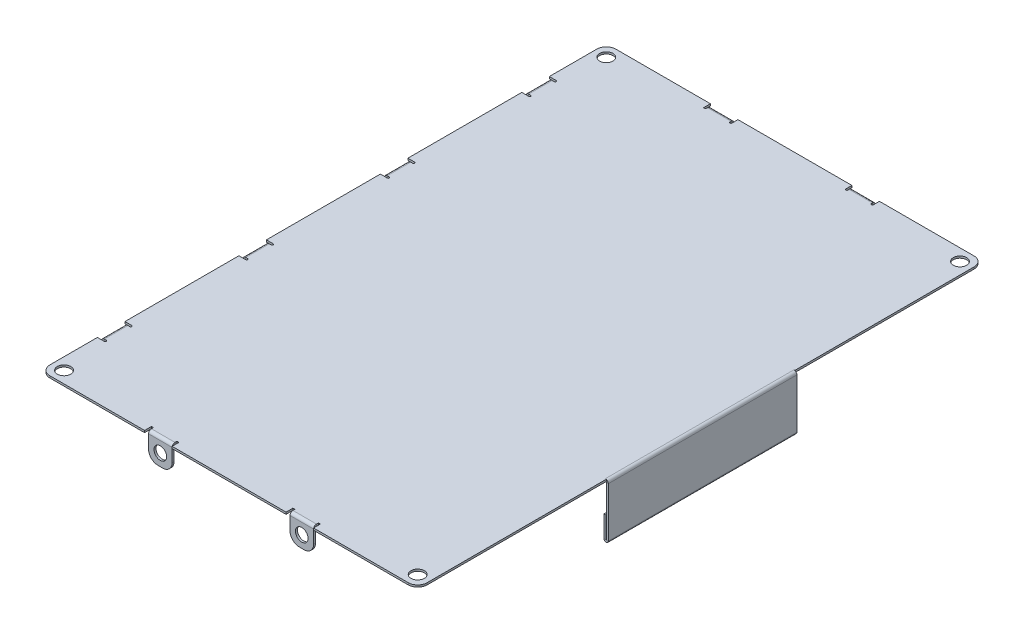
from build123d import *

# Parameters (mm, degrees)
BASE_FLANGE1_DEPTH             = 0.53
EDGE_FLANGE2_STRIP_W           = 3.158
EDGE_FLANGE2_STRIP_H           = 0.53
EDGE_FLANGE2_STRIP_CUT_DEPTH   = 6.35
EDGE_FLANGE2_RELIEF_W          = 3.688
EDGE_FLANGE2_RELIEF_H          = 0.53
EDGE_FLANGE2_RELIEF_CUT_DEPTH  = 0.53
EDGE_FLANGE2_DEPTH             = 6.35
EDGE_FLANGE2_FLAT_DEPTH        = 0.53
EDGE_FLANGE4_START             = -0.53
EDGE_FLANGE4_OUTLINE_W         = 7.41
EDGE_FLANGE4_OUTLINE_H         = 0.53
EDGE_FLANGE4_DEPTH             = 0.53
EDGE_FLANGE4_START_2           = -1.844
EDGE_FLANGE4_2_OUTLINE_W       = 0.53
EDGE_FLANGE4_2_OUTLINE_H       = 0.53
EDGE_FLANGE4_2_DEPTH           = 1.314
EDGE_FLANGE4_START_3           = 33.411716927
EDGE_FLANGE4_3_DEPTH           = 1.588283073
EDGE_FLANGE4_START_4           = 29.624923007
EDGE_FLANGE4_4_OUTLINE_W       = 0.53
EDGE_FLANGE4_4_OUTLINE_H       = 6.35
EDGE_FLANGE4_4_DEPTH           = 3.556
EDGE_FLANGE4_START_5           = -25.124
EDGE_FLANGE4_5_DEPTH           = 0.53
EDGE_FLANGE4_START_6           = -60.323203949
EDGE_FLANGE4_6_DEPTH           = 6.35
EDGE_FLANGE4_7_DEPTH           = 6.35
EDGE_FLANGE5_START             = -0.53
EDGE_FLANGE5_OUTLINE_W         = 7.41
EDGE_FLANGE5_OUTLINE_H         = 0.53
EDGE_FLANGE5_DEPTH             = 0.53
EDGE_FLANGE5_START_2           = -1.844
EDGE_FLANGE5_2_OUTLINE_W       = 0.53
EDGE_FLANGE5_2_OUTLINE_H       = 0.53
EDGE_FLANGE5_2_DEPTH           = 1.314
EDGE_FLANGE5_START_3           = -22.223203949
EDGE_FLANGE5_3_DEPTH           = 6.35
EDGE_FLANGE5_4_DEPTH           = 6.35
EDGE_FLANGE5_START_4           = 29.47371193
EDGE_FLANGE5_5_DEPTH           = 5.52628807
EDGE_FLANGE5_START_5           = -25.124
EDGE_FLANGE5_6_DEPTH           = 0.53
M3_CLEARANCE_HOLE2_D           = 3.4
M3_CLEARANCE_HOLE2_ON_FACE_2_D = 3.4
EDGE_FLANGE6_STRIP_W           = 2.628
EDGE_FLANGE6_STRIP_H           = 0.53
EDGE_FLANGE6_STRIP_CUT_DEPTH   = 25.4
EDGE_FLANGE6_DEPTH             = 25.4
HEM1_START                     = -76.198203949
HEM1_DEPTH                     = 25.4
HEM1_2_DEPTH                   = 25.4
M3_CLEARANCE_HOLE1_D           = 3.6


with BuildPart() as part:
    # Base-Flange1: sheet metal written as solids
    # Sketch1 → Base-Flange1 (new body)
    with BuildSketch(Plane(origin=(0, 33.434923007, 0), x_dir=(1, 0, 0), z_dir=(0, 1, 0))):
        with BuildLine():
            Line((-23.114, 0), (25.146, 0))
            Line((25.146, 0), (25.146, 76.198203949))
            Line((25.146, 76.198203949), (-25.654, 76.198203949))
            Line((-25.654, 76.198203949), (-25.654, 2.54))
            ThreePointArc((-25.654, 2.54), (-24.910051224, 0.743948776), (-23.114, 0))
        make_face()
    extrude(amount=BASE_FLANGE1_DEPTH)

    # Edge-Flange2: sheet metal written as solids
    # Edge-Flange2 strip (on a plane across the edge) → Edge-Flange2 strip cut (cut)
    with BuildSketch(Plane(origin=(9.271, 33.434923007, -0.53), x_dir=(0, 0, -1), z_dir=(-1, 0, 0))):
        with Locations((-0.795, -0.265)):
            Rectangle(EDGE_FLANGE2_STRIP_W, EDGE_FLANGE2_STRIP_H)
    extrude(amount=EDGE_FLANGE2_STRIP_CUT_DEPTH, mode=Mode.SUBTRACT)

    # Edge-Flange2 relief (on the sheet) → Edge-Flange2 relief cut (cut)
    with BuildSketch(Plane(origin=(9.271, 33.434923007, -1.314), x_dir=(0, 0, -1), z_dir=(0, -1, 0))):
        with Locations((-1.314, 0.265)):
            Rectangle(EDGE_FLANGE2_RELIEF_W, EDGE_FLANGE2_RELIEF_H)
        with Locations((-1.314, -6.615)):
            Rectangle(EDGE_FLANGE2_RELIEF_W, EDGE_FLANGE2_RELIEF_H)
    extrude(amount=-EDGE_FLANGE2_RELIEF_CUT_DEPTH, mode=Mode.SUBTRACT)

    # Edge-Flange2 bend section (on a plane across the edge) → Edge-Flange2 (add)
    with BuildSketch(Plane(origin=(9.271, 33.434923007, -0.53), x_dir=(0, 0, -1), z_dir=(-1, 0, 0))):
        with BuildLine():
            Line((0, 0.254), (0.53, 0.254))
            ThreePointArc((0.53, 0.254), (0.604394878, 0.074394878), (0.784, 0))
            Line((0.784, 0), (0.784, -0.53))
            ThreePointArc((0.784, -0.53), (0.229628284, -0.300371716), (0, 0.254))
        make_face()
    extrude(amount=EDGE_FLANGE2_DEPTH)

    # Edge-Flange2 profile (on flange) → Edge-Flange2 flat (add)
    with BuildSketch(Plane(origin=(0, 33.434923007, -0.53), x_dir=(-1, 0, 0), z_dir=(0, 0, 1))):
        with BuildLine():
            Line((-9.271, 0.254), (-2.921, 0.254))
            Line((-2.921, 0.254), (-2.921, 3.81))
            ThreePointArc((-2.921, 3.81), (-3.664948776, 5.606051224), (-5.461, 6.35))
            Line((-5.461, 6.35), (-6.731, 6.35))
            ThreePointArc((-6.731, 6.35), (-8.527051224, 5.606051224), (-9.271, 3.81))
            Line((-9.271, 3.81), (-9.271, 0.254))
        make_face()
    extrude(amount=-EDGE_FLANGE2_FLAT_DEPTH)

    # Mirror2: part across plane


with BuildPart() as part_1:
    add(part.part)
    add(part.part.mirror(Plane(origin=(25.146, 33.964923007, 0), x_dir=(0, 0, 1), z_dir=(-1, 0, 0))))

    # Edge-Flange4: read off the stored shape, not the designer's step
    # Edge-Flange4 outline → Edge-Flange4 (cut)
    with BuildSketch(Plane(origin=(-25.654, 33.434923007, 0), x_dir=(0, 0, -1), z_dir=(-1, 0, 0)).offset(EDGE_FLANGE4_START)):
        with Locations((57.148203949, -0.265)):
            Rectangle(EDGE_FLANGE4_OUTLINE_W, EDGE_FLANGE4_OUTLINE_H)
    extrude(amount=EDGE_FLANGE4_DEPTH, mode=Mode.SUBTRACT)

    # Edge-Flange4 2 outline → Edge-Flange4 2 (cut)
    with BuildSketch(Plane(origin=(-25.654, 33.434923007, 0), x_dir=(0, 0, -1), z_dir=(-1, 0, 0)).offset(EDGE_FLANGE4_START_2)):
        with Locations((53.708203949, -0.265)):
            Rectangle(EDGE_FLANGE4_2_OUTLINE_W, EDGE_FLANGE4_2_OUTLINE_H)
        with Locations((60.588203949, -0.265)):
            Rectangle(EDGE_FLANGE4_2_OUTLINE_W, EDGE_FLANGE4_2_OUTLINE_H)
    extrude(amount=EDGE_FLANGE4_2_DEPTH, mode=Mode.SUBTRACT)

    # Edge-Flange4 3 outline → Edge-Flange4 3 (cut)
    with BuildSketch(Plane(origin=(0, 0, 0), x_dir=(1, 0, 0), z_dir=(0, 1, 0)).offset(EDGE_FLANGE4_START_3)):
        with BuildLine():
            Line((-23.81, 60.853203949), (-23.81, 60.323203949))
            ThreePointArc((-23.81, 60.323203949), (-23.545, 60.588203949), (-23.81, 60.853203949))
        make_face()
        with BuildLine():
            ThreePointArc((-23.81, 53.443203949), (-23.545, 53.708203949), (-23.81, 53.973203949))
            Line((-23.81, 53.973203949), (-23.81, 53.443203949))
        make_face()
    extrude(amount=EDGE_FLANGE4_3_DEPTH, mode=Mode.SUBTRACT)



with BuildPart() as body_2:
    # Edge-Flange4 4 outline → Edge-Flange4 4 (new body)
    with BuildSketch(Plane(origin=(0, 0, 0), x_dir=(1, 0, 0), z_dir=(0, 1, 0)).offset(EDGE_FLANGE4_START_4)):
        with Locations((-24.859, 57.148203949)):
            Rectangle(EDGE_FLANGE4_4_OUTLINE_W, EDGE_FLANGE4_4_OUTLINE_H)
    extrude(amount=EDGE_FLANGE4_4_DEPTH)

    # Edge-Flange4 5 outline → Edge-Flange4 5 (add)
    with BuildSketch(Plane.YZ.offset(EDGE_FLANGE4_START_5)):
        with BuildLine():
            Line((27.084923007, -56.513203949), (27.084923007, -57.783203949))
            ThreePointArc((27.084923007, -57.783203949), (27.828871783, -59.579255173), (29.624923007, -60.323203949))
            Line((29.624923007, -60.323203949), (29.624923007, -53.973203949))
            ThreePointArc((29.624923007, -53.973203949), (27.828871783, -54.717152725), (27.084923007, -56.513203949))
        make_face()
    extrude(amount=EDGE_FLANGE4_5_DEPTH)


with BuildPart() as part_2:
    add(part_1.part)

    add(body_2.part)  # Edge-Flange4 6 merges body 2
    # Edge-Flange4 6 outline → Edge-Flange4 6 (add)
    with BuildSketch(Plane.XY.offset(EDGE_FLANGE4_START_6)):
        with BuildLine():
            ThreePointArc((-25.08171423, 33.434923007), (-25.113356307, 33.309670906), (-25.124, 33.180923007))
            Line((-25.124, 33.180923007), (-24.594, 33.180923007))
            ThreePointArc((-24.594, 33.180923007), (-24.519605122, 33.360528129), (-24.34, 33.434923007))
            Line((-24.34, 33.434923007), (-25.08171423, 33.434923007))
        make_face()
    extrude(amount=EDGE_FLANGE4_6_DEPTH)

    # Edge-Flange4 7 outline → Edge-Flange4 7 (cut)
    with BuildSketch(Plane.XY.offset(EDGE_FLANGE4_START_6)):
        with BuildLine():
            Line((-25.124, 33.434923007), (-25.08171423, 33.434923007))
            ThreePointArc((-25.08171423, 33.434923007), (-24.795806976, 33.818807009), (-24.34, 33.964923007))
            Line((-24.34, 33.964923007), (-25.124, 33.964923007))
            Line((-25.124, 33.964923007), (-25.124, 33.434923007))
        make_face()
    extrude(amount=EDGE_FLANGE4_7_DEPTH, mode=Mode.SUBTRACT)

    # Edge-Flange5: read off the stored shape, not the designer's step
    # Edge-Flange5 outline → Edge-Flange5 (cut)
    with BuildSketch(Plane(origin=(-25.654, 33.434923007, 0), x_dir=(0, 0, -1), z_dir=(-1, 0, 0)).offset(EDGE_FLANGE5_START)):
        with Locations((19.048203949, -0.265)):
            Rectangle(EDGE_FLANGE5_OUTLINE_W, EDGE_FLANGE5_OUTLINE_H)
    extrude(amount=EDGE_FLANGE5_DEPTH, mode=Mode.SUBTRACT)

    # Edge-Flange5 2 outline → Edge-Flange5 2 (cut)
    with BuildSketch(Plane(origin=(-25.654, 33.434923007, 0), x_dir=(0, 0, -1), z_dir=(-1, 0, 0)).offset(EDGE_FLANGE5_START_2)):
        with Locations((15.608203949, -0.265)):
            Rectangle(EDGE_FLANGE5_2_OUTLINE_W, EDGE_FLANGE5_2_OUTLINE_H)
        with Locations((22.488203949, -0.265)):
            Rectangle(EDGE_FLANGE5_2_OUTLINE_W, EDGE_FLANGE5_2_OUTLINE_H)
    extrude(amount=EDGE_FLANGE5_2_DEPTH, mode=Mode.SUBTRACT)

    # Edge-Flange5 3 outline → Edge-Flange5 3 (cut)
    with BuildSketch(Plane.XY.offset(EDGE_FLANGE5_START_3)):
        with BuildLine():
            Line((-25.124, 33.434923007), (-25.08171423, 33.434923007))
            ThreePointArc((-25.08171423, 33.434923007), (-24.795806976, 33.818807009), (-24.34, 33.964923007))
            Line((-24.34, 33.964923007), (-25.124, 33.964923007))
            Line((-25.124, 33.964923007), (-25.124, 33.434923007))
        make_face()
    extrude(amount=EDGE_FLANGE5_3_DEPTH, mode=Mode.SUBTRACT)

    # Edge-Flange5 4 outline → Edge-Flange5 4 (add)
    with BuildSketch(Plane.XY.offset(EDGE_FLANGE5_START_3)):
        with BuildLine():
            Line((-25.124, 27.084923007), (-24.594, 27.084923007))
            Line((-24.594, 27.084923007), (-24.594, 33.180923007))
            ThreePointArc((-24.594, 33.180923007), (-24.519605122, 33.360528129), (-24.34, 33.434923007))
            Line((-24.34, 33.434923007), (-25.08171423, 33.434923007))
            ThreePointArc((-25.08171423, 33.434923007), (-25.113356307, 33.309670906), (-25.124, 33.180923007))
            Line((-25.124, 33.180923007), (-25.124, 27.084923007))
        make_face()
    extrude(amount=EDGE_FLANGE5_4_DEPTH)

    # Edge-Flange5 5 outline → Edge-Flange5 5 (cut)
    with BuildSketch(Plane(origin=(0, 0, 0), x_dir=(1, 0, 0), z_dir=(0, 1, 0)).offset(EDGE_FLANGE5_START_4)):
        with BuildLine():
            Line((-23.81, 22.753203949), (-23.81, 22.223203949))
            ThreePointArc((-23.81, 22.223203949), (-23.545, 22.488203949), (-23.81, 22.753203949))
        make_face()
        with BuildLine():
            Line((-23.81, 15.873203949), (-23.81, 15.343203949))
            ThreePointArc((-23.81, 15.343203949), (-23.545, 15.608203949), (-23.81, 15.873203949))
        make_face()
    extrude(amount=EDGE_FLANGE5_5_DEPTH, mode=Mode.SUBTRACT)

    # Edge-Flange5 6 outline → Edge-Flange5 6 (cut)
    with BuildSketch(Plane.YZ.offset(EDGE_FLANGE5_START_5)):
        with BuildLine():
            ThreePointArc((29.624923007, -22.223203949), (27.828871783, -21.479255173), (27.084923007, -19.683203949))
            Line((27.084923007, -19.683203949), (27.084923007, -22.223203949))
            Line((27.084923007, -22.223203949), (29.624923007, -22.223203949))
        make_face()
        with BuildLine():
            Line((27.084923007, -15.873203949), (27.084923007, -18.413203949))
            ThreePointArc((27.084923007, -18.413203949), (27.828871783, -16.617152725), (29.624923007, -15.873203949))
            Line((29.624923007, -15.873203949), (27.084923007, -15.873203949))
        make_face()
    extrude(amount=EDGE_FLANGE5_6_DEPTH, mode=Mode.SUBTRACT)

    # M3 Clearance Hole2 (through all)
    with Locations(Plane(origin=(-24.594, 30.259923007, -57.148203949), x_dir=(0, 1, 0), z_dir=(1, 0, 0))):
        with Locations((0, 0), (0, 38.1)):
            Hole(M3_CLEARANCE_HOLE2_D / 2)

    # M3 Clearance Hole2 on face 2 (through all)
    with Locations(Plane(origin=(6.096, 30.259923007, -1.06), x_dir=(-1, 0, 0), z_dir=(0, 0, -1))):
        with Locations((0, 0), (-38.1, 0)):
            Hole(M3_CLEARANCE_HOLE2_ON_FACE_2_D / 2)

    # Edge-Flange6: sheet metal written as solids
    # Edge-Flange6 strip (on a plane across the edge) → Edge-Flange6 strip cut (cut)
    with BuildSketch(Plane(origin=(75.946, 33.434923007, -76.198203949), x_dir=(-1, 0, 0), z_dir=(0, 0, 1))):
        with Locations((-1.06, -0.265)):
            Rectangle(EDGE_FLANGE6_STRIP_W, EDGE_FLANGE6_STRIP_H)
    extrude(amount=EDGE_FLANGE6_STRIP_CUT_DEPTH, mode=Mode.SUBTRACT)

    # Edge-Flange6 section (on a plane across the edge) → Edge-Flange6 (add)
    with BuildSketch(Plane(origin=(75.946, 33.434923007, -76.198203949), x_dir=(-1, 0, 0), z_dir=(0, 0, 1))):
        with BuildLine():
            Line((-0.53, 0.254), (-0.53, 14.224))
            Line((-0.53, 14.224), (0, 14.224))
            Line((0, 14.224), (0, 0.254))
            ThreePointArc((0, 0.254), (0.074394878, 0.074394878), (0.254, 0))
            Line((0.254, 0), (0.254, -0.53))
            ThreePointArc((0.254, -0.53), (-0.300371716, -0.300371716), (-0.53, 0.254))
        make_face()
    extrude(amount=EDGE_FLANGE6_DEPTH)

    # Hem1: read off the stored shape, not the designer's step
    # Hem1 outline → Hem1 (cut)
    with BuildSketch(Plane.XY.offset(HEM1_START)):
        with BuildLine():
            ThreePointArc((76.476, 19.790923007), (76.323434205, 19.398877091), (75.946, 19.213082198))
            Line((75.946, 19.213082198), (75.946, 19.210923007))
            Line((75.946, 19.210923007), (76.476, 19.210923007))
            Line((76.476, 19.210923007), (76.476, 19.790923007))
        make_face()
    extrude(amount=HEM1_DEPTH, mode=Mode.SUBTRACT)

    # Hem1 2 outline → Hem1 2 (add)
    with BuildSketch(Plane.XY.offset(HEM1_START)):
        with BuildLine():
            Line((75.846, 25.560923007), (75.316, 25.560923007))
            Line((75.316, 25.560923007), (75.316, 19.790923007))
            ThreePointArc((75.316, 19.790923007), (75.503954084, 19.363488802), (75.946, 19.213082198))
            Line((75.946, 19.213082198), (75.946, 19.790923007))
            ThreePointArc((75.946, 19.790923007), (75.896, 19.740923007), (75.846, 19.790923007))
            Line((75.846, 19.790923007), (75.846, 25.560923007))
        make_face()
    extrude(amount=HEM1_2_DEPTH)

    # M3 Clearance Hole1 (through all)
    with Locations(Plane(origin=(0, 33.964923007, 0), x_dir=(1, 0, 0), z_dir=(0, 1, 0))):
        with Locations((-22.479, 3.173203949), (72.771, 3.173203949)):
            Hole(M3_CLEARANCE_HOLE1_D / 2)

    # Mirror1: part across face


with BuildPart() as part_3:
    add(part_2.part)
    add(part_2.part.mirror(Plane(origin=(33.760295, 32.274506328, -76.198203949), x_dir=(1, 0, 0), z_dir=(0, 0, -1))))


solid = part_3.part
